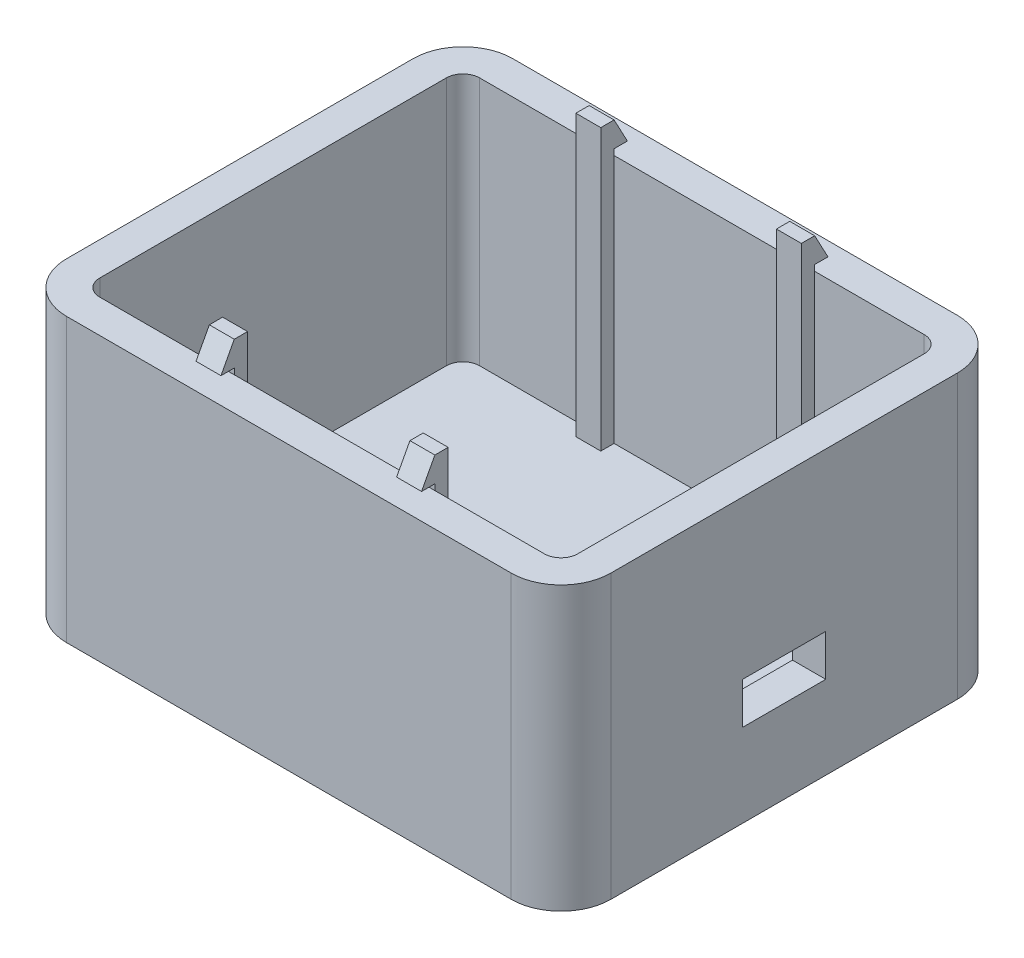
from build123d import *

# Parameters (mm, degrees)
BOSS_EXTRUDE1_DEPTH  = 38.1
SHELL1_T             = 5.08
SNAP_START           = -30.286635041
SNAP_HOOK1_DEPTH     = 3.81
MIRROR2_START        = -30.286635041
MIRROR2_COPY_1_DEPTH = 3.81
SKETCH2_W            = 12.7
SKETCH2_H            = 6.35
CUT_EXTRUDE1_DEPTH   = 19.304


# Read off the part's stored shape, not the designer's step: Snap Hook1
with BuildPart() as part:
    # Sketch1 → Boss-Extrude1 (new body)
    with BuildSketch(Plane(origin=(0, 0, 0), x_dir=(1, 0, 0), z_dir=(0, 1, 0))):
        with BuildLine():
            Line((-47.028877551, 32.634950255), (20.916122449, 32.634950255))
            ThreePointArc((20.916122449, 32.634950255), (22.712173673, 31.891001479), (23.456122449, 30.094950255))
            Line((23.456122449, 30.094950255), (23.456122449, -22.864049745))
            ThreePointArc((23.456122449, -22.864049745), (22.712173673, -24.660100969), (20.916122449, -25.404049745))
            Line((20.916122449, -25.404049745), (-47.028877551, -25.404049745))
            ThreePointArc((-47.028877551, -25.404049745), (-48.824928775, -24.660100969), (-49.568877551, -22.864049745))
            Line((-49.568877551, -22.864049745), (-49.568877551, 30.094950255))
            ThreePointArc((-49.568877551, 30.094950255), (-48.824928775, 31.891001479), (-47.028877551, 32.634950255))
        make_face()
    extrude(amount=BOSS_EXTRUDE1_DEPTH)

    # Shell1
    shell1_openings = [part.faces().sort_by_distance(p)[0] for p in [
        (-13.056377551, 38.1, -3.615450255),
    ]]
    offset(amount=SHELL1_T, openings=shell1_openings, kind=Kind.INTERSECTION)

    # Snap Hook1 outline → Snap Hook1 (add)
    with BuildSketch(Plane.YZ.offset(SNAP_START)):
        Polygon((38.998243942, -34.666950255), (42.808243942, -32.634950255), (42.808243942, -30.602950255), (0, -30.602950255), (0, -32.634950255), (38.998243942, -32.634950255), align=None)
    snap_hook1 = extrude(amount=SNAP_HOOK1_DEPTH)

    # Mirror1: Snap Hook1 across plane
    add(snap_hook1.mirror(Plane.XY.offset(-3.615450255)))

    # Mirror2: Snap Hook1 across plane
    add(snap_hook1.mirror(Plane(origin=(-13.056377551, 0, 0), x_dir=(0, 0, 1), z_dir=(1, 0, 0))))

    # Mirror2 copy 1 sketch → Mirror2 copy 1 (add)
    with BuildSketch(Plane(origin=(-26.112755102, 0, -7.23090051), x_dir=(0, 1, 0), z_dir=(-1, 0, 0)).offset(MIRROR2_START)):
        Polygon((38.998243942, -34.666950255), (42.808243942, -32.634950255), (42.808243942, -30.602950255), (0, -30.602950255), (0, -32.634950255), (38.998243942, -32.634950255), align=None)
    extrude(amount=MIRROR2_COPY_1_DEPTH)

    # Sketch2 → Cut-Extrude1 (cut)
    with BuildSketch(Plane(origin=(28.536122449, 0, 0), x_dir=(0, 0, -1), z_dir=(1, 0, 0))):
        with Locations((3.615450255, 10.795)):
            Rectangle(SKETCH2_W, SKETCH2_H)
    extrude(amount=-CUT_EXTRUDE1_DEPTH, mode=Mode.SUBTRACT)


solid = part.part
